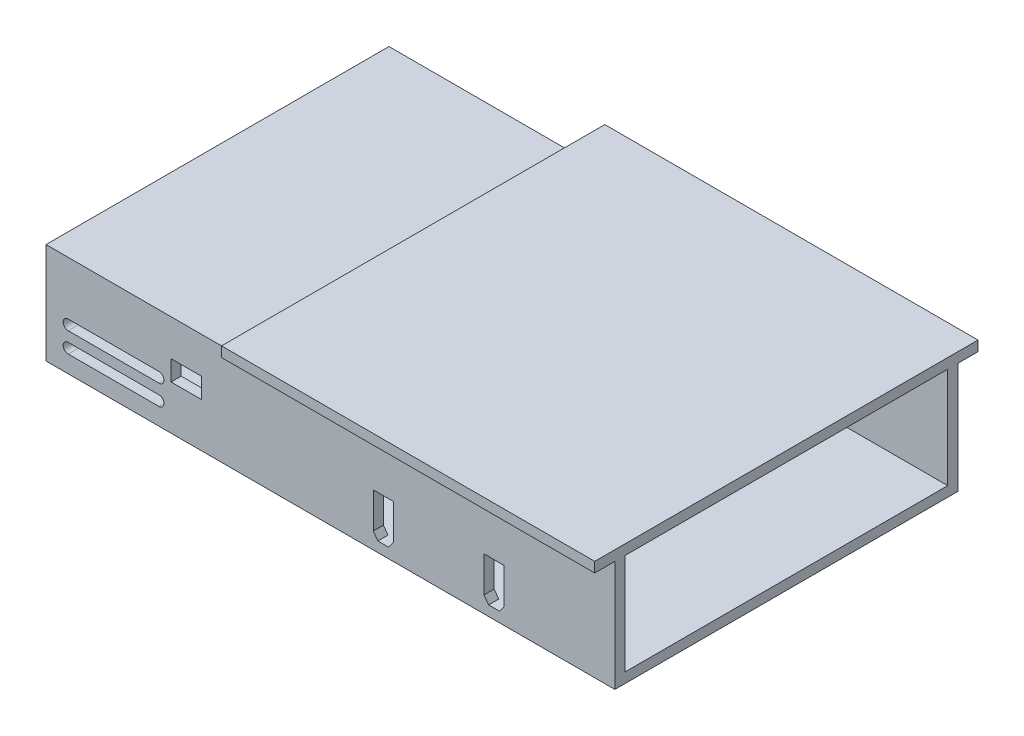
from build123d import *

# Parameters (mm, degrees)
SKETCH1_W           = 282
SKETCH1_H           = 170
BOSS_EXTRUDE1_DEPTH = 60
CUT_EXTRUDE4_DEPTH  = 5
SKETCH8_W           = 160
SKETCH8_H           = 50
CUT_EXTRUDE5_DEPTH  = 279
CUT_EXTRUDE6_DEPTH  = 5
SKETCH10_R          = 5
CUT_EXTRUDE7_DEPTH  = 5
CUT_EXTRUDE8_DEPTH  = 5
CUT_EXTRUDE9_START  = -5
CUT_EXTRUDE9_DEPTH  = 5
SKETCH14_W          = 185
SKETCH14_H          = 5
BOSS_EXTRUDE2_DEPTH = 10
SKETCH15_W          = 185
SKETCH15_H          = 5
BOSS_EXTRUDE3_DEPTH = 10
SKETCH16_W          = 97
SKETCH16_H          = 10
CUT_EXTRUDE10_DEPTH = 170
BOSS_EXTRUDE4_DEPTH = 160
SKETCH18_W          = 15
SKETCH18_H          = 10
CUT_EXTRUDE11_DEPTH = 340.888216918


with BuildPart() as part:
    # Sketch1 → Boss-Extrude1 (new body)
    with BuildSketch(Plane(origin=(0, 0, 0), x_dir=(1, 0, 0), z_dir=(0, 1, 0))):
        with Locations((141, 85)):
            Rectangle(SKETCH1_W, SKETCH1_H)
    extrude(amount=BOSS_EXTRUDE1_DEPTH)

    # Sketch7 → Cut-Extrude4 (cut)
    with BuildSketch(Plane.XZ):
        with BuildLine():
            Line((13.5, -37.5), (13.5, -132.5))
            ThreePointArc((13.5, -132.5), (11, -135), (8.5, -132.5))
            Line((8.5, -132.5), (8.5, -37.5))
            ThreePointArc((8.5, -37.5), (11, -35), (13.5, -37.5))
        make_face()
        with BuildLine():
            Line((58.5, -37.5), (58.5, -132.5))
            ThreePointArc((58.5, -132.5), (56, -135), (53.5, -132.5))
            Line((53.5, -132.5), (53.5, -37.5))
            ThreePointArc((53.5, -37.5), (56, -35), (58.5, -37.5))
        make_face()
        with BuildLine():
            Line((28.5, -37.5), (28.5, -132.5))
            ThreePointArc((28.5, -132.5), (26, -135), (23.5, -132.5))
            Line((23.5, -132.5), (23.5, -37.5))
            ThreePointArc((23.5, -37.5), (26, -35), (28.5, -37.5))
        make_face()
        with BuildLine():
            Line((43.5, -37.5), (43.5, -132.5))
            ThreePointArc((43.5, -132.5), (41, -135), (38.5, -132.5))
            Line((38.5, -132.5), (38.5, -37.5))
            ThreePointArc((38.5, -37.5), (41, -35), (43.5, -37.5))
        make_face()
    extrude(amount=-CUT_EXTRUDE4_DEPTH, mode=Mode.SUBTRACT)

    # Sketch8 → Cut-Extrude5 (cut)
    with BuildSketch(Plane(origin=(282, 0, 0), x_dir=(0, 0, -1), z_dir=(1, 0, 0))):
        with Locations((85, 30)):
            Rectangle(SKETCH8_W, SKETCH8_H)
    extrude(amount=-CUT_EXTRUDE5_DEPTH, mode=Mode.SUBTRACT)

    # Sketch9 → Cut-Extrude6 (cut)
    with BuildSketch(Plane.XY):
        Polygon((217.15, 25.8), (227.05, 25.8), (227.05, 8.15), (224.8, 5), (219.4, 5), (217.15, 8.15), align=None)
        Polygon((162.25, 25.8), (172.15, 25.8), (172.15, 8.15), (169.9, 5), (164.5, 5), (162.25, 8.15), align=None)
    extrude(amount=-CUT_EXTRUDE6_DEPTH, mode=Mode.SUBTRACT)

    # Sketch10 → Cut-Extrude7 (cut)
    with BuildSketch(Plane.ZY):
        with Locations((-129.202249563, 20)):
            Circle(SKETCH10_R)
        with Locations((-114.202249563, 20)):
            Circle(SKETCH10_R)
        with Locations((-99.202249563, 20)):
            Circle(SKETCH10_R)
        with Locations((-43.390057257, 20)):
            Circle(SKETCH10_R)
        with Locations((-58.390057257, 20)):
            Circle(SKETCH10_R)
        with Locations((-73.390057257, 20)):
            Circle(SKETCH10_R)
    extrude(amount=-CUT_EXTRUDE7_DEPTH, mode=Mode.SUBTRACT)

    # Sketch11 → Cut-Extrude8 (cut)
    with BuildSketch(Plane.XY):
        with BuildLine():
            Line((11, 13.5), (56, 13.5))
            ThreePointArc((56, 13.5), (58.5, 11), (56, 8.5))
            Line((56, 8.5), (11, 8.5))
            ThreePointArc((11, 8.5), (8.5, 11), (11, 13.5))
        make_face()
        with BuildLine():
            Line((11, 23.5), (56, 23.5))
            ThreePointArc((56, 23.5), (58.5, 21), (56, 18.5))
            Line((56, 18.5), (11, 18.5))
            ThreePointArc((11, 18.5), (8.5, 21), (11, 23.5))
        make_face()
    extrude(amount=-CUT_EXTRUDE8_DEPTH, mode=Mode.SUBTRACT)

    # Sketch12 → Cut-Extrude9 (cut)
    with BuildSketch(Plane(origin=(0, 0, -170), x_dir=(-1, 0, 0), z_dir=(0, 0, -1)).offset(CUT_EXTRUDE9_START)):
        with BuildLine():
            Line((-56, 13.5), (-11, 13.5))
            ThreePointArc((-11, 13.5), (-8.5, 11), (-11, 8.5))
            Line((-11, 8.5), (-56, 8.5))
            ThreePointArc((-56, 8.5), (-58.5, 11), (-56, 13.5))
        make_face()
        with BuildLine():
            Line((-56, 23.5), (-11, 23.5))
            ThreePointArc((-11, 23.5), (-8.5, 21), (-11, 18.5))
            Line((-11, 18.5), (-56, 18.5))
            ThreePointArc((-56, 18.5), (-58.5, 21), (-56, 23.5))
        make_face()
    extrude(amount=CUT_EXTRUDE9_DEPTH, mode=Mode.SUBTRACT)

    # Sketch14 → Boss-Extrude2 (add)
    with BuildSketch(Plane.XY):
        with Locations((189.5, 57.5)):
            Rectangle(SKETCH14_W, SKETCH14_H)
    extrude(amount=BOSS_EXTRUDE2_DEPTH)

    # Sketch15 → Boss-Extrude3 (add)
    with BuildSketch(Plane(origin=(0, 0, -170), x_dir=(-1, 0, 0), z_dir=(0, 0, -1))):
        with Locations((-189.5, 57.5)):
            Rectangle(SKETCH15_W, SKETCH15_H)
    extrude(amount=BOSS_EXTRUDE3_DEPTH)

    # Sketch16 → Cut-Extrude10 (cut)
    with BuildSketch(Plane.XY):
        with Locations((48.5, 55)):
            Rectangle(SKETCH16_W, SKETCH16_H)
    extrude(amount=-CUT_EXTRUDE10_DEPTH, mode=Mode.SUBTRACT)

    # Sketch17 → Boss-Extrude4 (add)
    with BuildSketch(Plane.XY.offset(-165)):
        Polygon((3, 50), (97, 50), (97, 55), (102, 55), (102, 45), (3, 45), align=None)
    extrude(amount=BOSS_EXTRUDE4_DEPTH)

    # Sketch18 → Cut-Extrude11 (cut, through all)
    with BuildSketch(Plane.XY):
        with Locations((69.5, 27)):
            Rectangle(SKETCH18_W, SKETCH18_H)
    extrude(amount=-CUT_EXTRUDE11_DEPTH, mode=Mode.SUBTRACT)


solid = part.part
